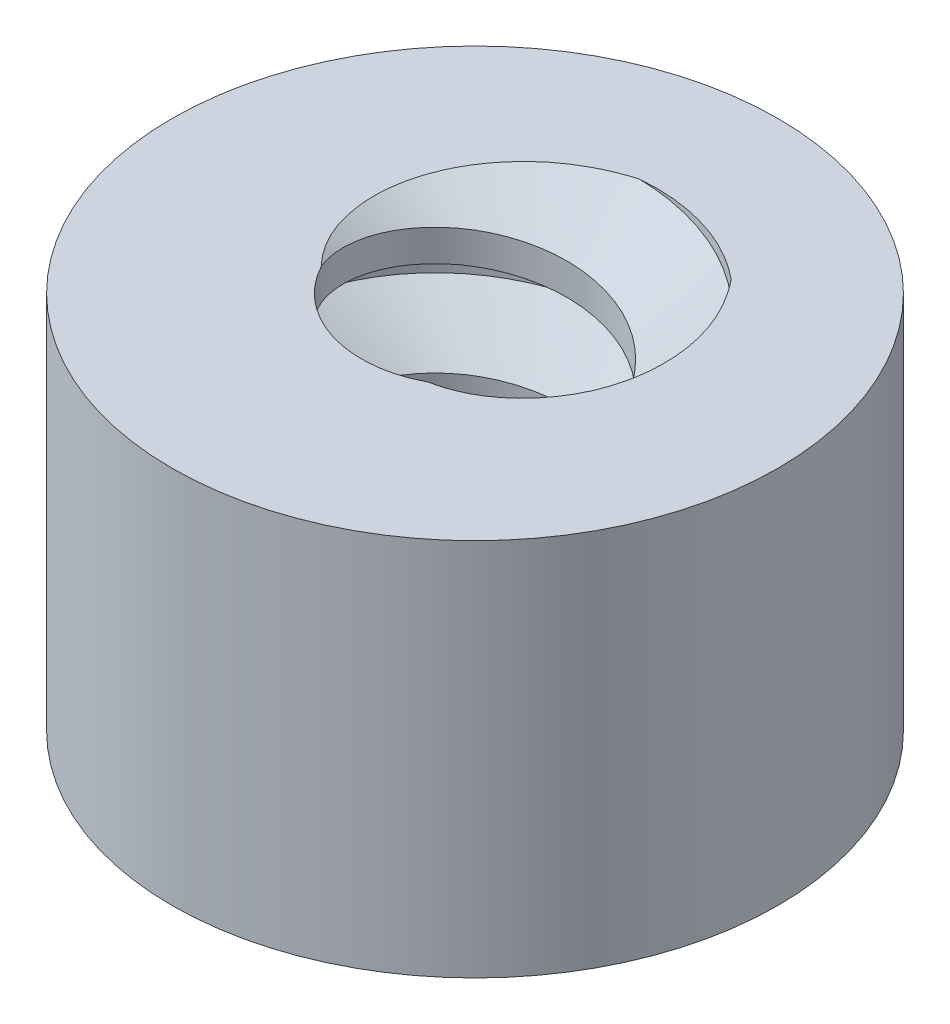
from build123d import *

# Parameters (mm, degrees)
SKETCH1_R           = 5.08
BOSS_EXTRUDE1_DEPTH = 6.35
SKETCH2_R           = 1.905
CUT_EXTRUDE1_DEPTH  = 10.588289733
THREAD1_PITCH       = 2.116666667


with BuildPart() as part:
    # Sketch1 → Boss-Extrude1 (new body)
    with BuildSketch(Plane(origin=(0, 0, 0), x_dir=(1, 0, 0), z_dir=(0, 1, 0))):
        with Locations(Location((0, 0, 0), (0, 0, 270))):
            Circle(SKETCH1_R)
    extrude(amount=BOSS_EXTRUDE1_DEPTH)

    # Sketch2 → Cut-Extrude1 (cut, through all)
    with BuildSketch(Plane(origin=(0, 6.35, 0), x_dir=(1, 0, 0), z_dir=(0, 1, 0))):
        with Locations(Location((0, 0, 0), (0, 0, 270))):
            Circle(SKETCH2_R)
    extrude(amount=-CUT_EXTRUDE1_DEPTH, mode=Mode.SUBTRACT)

    # Thread1: the profile of Thread Profile1 profile screwed along a right-hand helix of 5.924409 turns, 10 arcs to a turn; built about Z, then put on its axis
    thread1_z = Axis((0, 0, 0), (0, 0, 1))
    thread1_corners = [(1.9047, 0, -0.000173205), (3.050679435, 0, 0.66145833), (3.050679435, 0, 0.926041664), (1.9047, 0, 1.587673199)]
    with BuildLine(mode=Mode.PRIVATE) as thread1_profile:
        Line(thread1_corners[0], thread1_corners[1])
        Line(thread1_corners[1], thread1_corners[2])
        Line(thread1_corners[2], thread1_corners[3])
        Line(thread1_corners[3], thread1_corners[0])
    thread1_cap = Face(thread1_profile.wire())
    thread1_turn_angles = [0, 18, 36, 54, 72, 90, 108, 126, 144, 162, 180, 198, 216, 234, 252, 270, 288, 306, 324, 342, 360]
    thread1_turn_weights = [1, 0.9510565162951535, 1, 0.9510565162951535, 1, 0.9510565162951535, 1, 0.9510565162951535, 1, 0.9510565162951535, 1, 0.9510565162951535, 1, 0.9510565162951535, 1, 0.9510565162951535, 1, 0.9510565162951535, 1, 0.9510565162951535, 1]
    thread1_turn_rails = [Edge.make_bspline([Vector(p[0], p[1], 0).rotate(thread1_z, thread1_turn_angles[k]) / thread1_turn_weights[k] + Vector(0, 0, p[2] + THREAD1_PITCH * thread1_turn_angles[k] / 360) for k in range(21)], [0, 0, 0, 1, 1, 2, 2, 3, 3, 4, 4, 5, 5, 6, 6, 7, 7, 8, 8, 9, 9, 10, 10, 10], 2, thread1_turn_weights) for p in thread1_corners]
    thread1_turn_sides = [Face.make_surface_from_curves(thread1_turn_rails[p[0]], thread1_turn_rails[p[1]]) for p in [(0, 1), (1, 2), (2, 3), (3, 0)]]
    thread1_last_angles = [1800, 1818, 1836, 1854, 1872, 1890, 1908, 1926, 1944, 1962, 1980, 1998, 2016, 2034, 2052, 2070, 2088, 2106, 2124, 2128.393700787, 2132.787401575]
    thread1_last_weights = [1, 0.9510565162951535, 1, 0.9510565162951535, 1, 0.9510565162951535, 1, 0.9510565162951535, 1, 0.9510565162951535, 1, 0.9510565162951535, 1, 0.9510565162951535, 1, 0.9510565162951535, 1, 0.9510565162951535, 1, 0.9970611808444931, 1]
    thread1_last_rails = [Edge.make_bspline([Vector(p[0], p[1], 0).rotate(thread1_z, thread1_last_angles[k]) / thread1_last_weights[k] + Vector(0, 0, p[2] + THREAD1_PITCH * thread1_last_angles[k] / 360) for k in range(21)], [0, 0, 0, 1, 1, 2, 2, 3, 3, 4, 4, 5, 5, 6, 6, 7, 7, 8, 8, 9, 9, 10, 10, 10], 2, thread1_last_weights) for p in thread1_corners]
    thread1_last_sides = [Face.make_surface_from_curves(thread1_last_rails[p[0]], thread1_last_rails[p[1]]) for p in [(0, 1), (1, 2), (2, 3), (3, 0)]]
    thread1 = Plane(origin=(0, 9.89, 0), x_dir=(-1, 0, 0), z_dir=(0, -1, 0)) * Solid(Shell([*[p.moved(Location((0, 0, THREAD1_PITCH * i))) for i in range(5) for p in thread1_turn_sides], *thread1_last_sides, thread1_cap, thread1_cap.rotate(thread1_z, 2132.787401575).moved(Location((0, 0, THREAD1_PITCH * 2132.787401575 / 360)))]))
    add(thread1, mode=Mode.SUBTRACT)


solid = part.part
